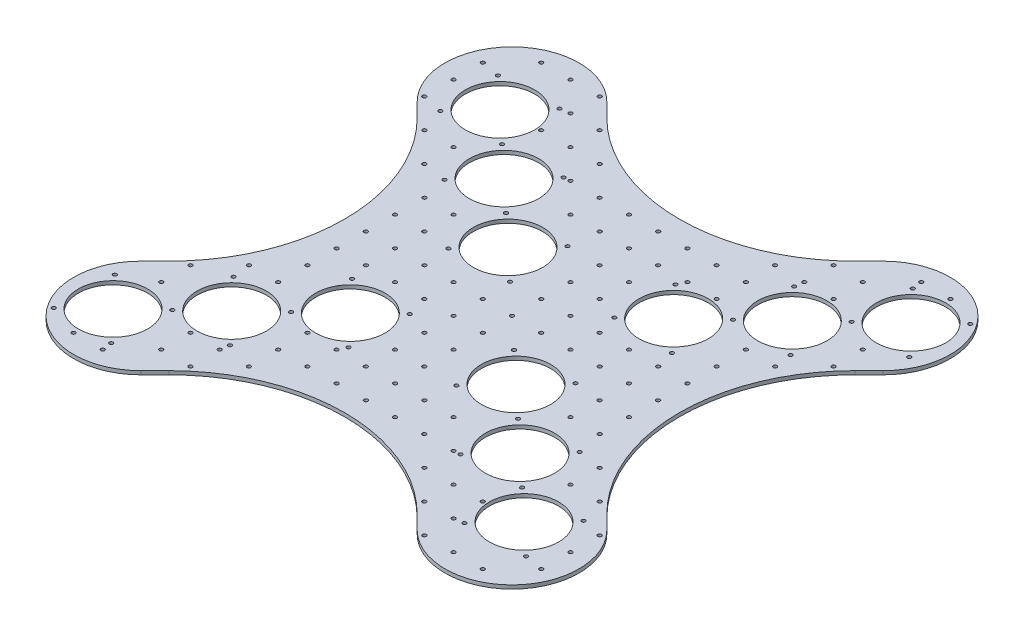
from build123d import *

# Parameters (mm, degrees)
BOSS_EXTRUDE1_DEPTH          = 1.5875
SKETCH4_R                    = 30.13075
CUT_EXTRUDE1_DEPTH           = 21.5875
SKETCH6_R                    = 30.13075
CUT_EXTRUDE2_DEPTH           = 21.5875
CIRPATTERN1_COUNT            = 2
SKETCH7_R                    = 1.625
CUT_EXTRUDE3_DEPTH           = 311.459884602
LPATTERN1_COUNT              = 9
LPATTERN1_PITCH              = 25.4
LPATTERN1_COUNT_DIR2         = 9
LPATTERN1_PITCH_DIR2         = 25.4
LPATTERN2_COUNT              = 9
LPATTERN2_PITCH              = 25.4
LPATTERN2_COUNT_DIR2         = 9
LPATTERN2_PITCH_DIR2         = 25.4
SKETCH8_R                    = 1.625
CUT_EXTRUDE4_DEPTH           = 21.5875
CIRPATTERN2_COUNT            = 2
CIRPATTERN2_COPY_1_SKETCH_R  = 1.625
CIRPATTERN2_COPY_1_DEPTH     = 311.459884602
CIRPATTERN2_COPY_2_SKETCH_R  = 1.625
CIRPATTERN2_COPY_2_DEPTH     = 311.459884602
CIRPATTERN2_COPY_3_SKETCH_R  = 1.625
CIRPATTERN2_COPY_3_DEPTH     = 311.459884602
CIRPATTERN2_COPY_4_SKETCH_R  = 1.625
CIRPATTERN2_COPY_4_DEPTH     = 311.459884602
CIRPATTERN2_COPY_5_SKETCH_R  = 1.625
CIRPATTERN2_COPY_5_DEPTH     = 311.459884602
CIRPATTERN2_COPY_6_SKETCH_R  = 1.625
CIRPATTERN2_COPY_6_DEPTH     = 311.459884602
CIRPATTERN2_COPY_7_SKETCH_R  = 1.625
CIRPATTERN2_COPY_7_DEPTH     = 311.459884602
CIRPATTERN2_COPY_8_SKETCH_R  = 1.625
CIRPATTERN2_COPY_8_DEPTH     = 311.459884602
CIRPATTERN2_COPY_9_SKETCH_R  = 1.625
CIRPATTERN2_COPY_9_DEPTH     = 311.459884602
CIRPATTERN2_COPY_10_SKETCH_R = 1.625
CIRPATTERN2_COPY_10_DEPTH    = 311.459884602
CIRPATTERN2_COPY_11_SKETCH_R = 1.625
CIRPATTERN2_COPY_11_DEPTH    = 311.459884602
CIRPATTERN2_COPY_12_SKETCH_R = 1.625
CIRPATTERN2_COPY_12_DEPTH    = 311.459884602
CIRPATTERN2_COPY_13_SKETCH_R = 1.625
CIRPATTERN2_COPY_13_DEPTH    = 311.459884602
CIRPATTERN2_COPY_14_SKETCH_R = 1.625
CIRPATTERN2_COPY_14_DEPTH    = 311.459884602
CIRPATTERN2_COPY_15_SKETCH_R = 1.625
CIRPATTERN2_COPY_15_DEPTH    = 311.459884602
CIRPATTERN2_COPY_16_SKETCH_R = 1.625
CIRPATTERN2_COPY_16_DEPTH    = 311.459884602
CIRPATTERN2_COPY_17_SKETCH_R = 1.625
CIRPATTERN2_COPY_17_DEPTH    = 311.459884602
CIRPATTERN2_COPY_18_SKETCH_R = 1.625
CIRPATTERN2_COPY_18_DEPTH    = 311.459884602
CIRPATTERN2_COPY_19_SKETCH_R = 1.625
CIRPATTERN2_COPY_19_DEPTH    = 311.459884602
CIRPATTERN2_COPY_20_SKETCH_R = 1.625
CIRPATTERN2_COPY_20_DEPTH    = 311.459884602
CIRPATTERN2_COPY_21_SKETCH_R = 1.625
CIRPATTERN2_COPY_21_DEPTH    = 311.459884602
CIRPATTERN2_COPY_22_SKETCH_R = 1.625
CIRPATTERN2_COPY_22_DEPTH    = 311.459884602
CIRPATTERN2_COPY_23_SKETCH_R = 1.625
CIRPATTERN2_COPY_23_DEPTH    = 311.459884602
CIRPATTERN2_COPY_24_SKETCH_R = 1.625
CIRPATTERN2_COPY_24_DEPTH    = 311.459884602
CIRPATTERN2_COPY_25_SKETCH_R = 1.625
CIRPATTERN2_COPY_25_DEPTH    = 311.459884602
CIRPATTERN2_COPY_26_SKETCH_R = 1.625
CIRPATTERN2_COPY_26_DEPTH    = 311.459884602
CIRPATTERN2_COPY_27_SKETCH_R = 1.625
CIRPATTERN2_COPY_27_DEPTH    = 311.459884602
CIRPATTERN2_COPY_28_SKETCH_R = 1.625
CIRPATTERN2_COPY_28_DEPTH    = 311.459884602
CIRPATTERN2_COPY_29_SKETCH_R = 1.625
CIRPATTERN2_COPY_29_DEPTH    = 311.459884602
CIRPATTERN2_COPY_30_SKETCH_R = 1.625
CIRPATTERN2_COPY_30_DEPTH    = 311.459884602
CIRPATTERN2_COPY_31_SKETCH_R = 1.625
CIRPATTERN2_COPY_31_DEPTH    = 311.459884602
CIRPATTERN2_COPY_32_SKETCH_R = 1.625
CIRPATTERN2_COPY_32_DEPTH    = 311.459884602
CIRPATTERN2_COPY_33_SKETCH_R = 1.625
CIRPATTERN2_COPY_33_DEPTH    = 311.459884602
CIRPATTERN2_COPY_34_SKETCH_R = 1.625
CIRPATTERN2_COPY_34_DEPTH    = 311.459884602
CIRPATTERN2_COPY_35_SKETCH_R = 1.625
CIRPATTERN2_COPY_35_DEPTH    = 311.459884602
CIRPATTERN2_COPY_36_SKETCH_R = 1.625
CIRPATTERN2_COPY_36_DEPTH    = 311.459884602
CIRPATTERN2_COPY_37_SKETCH_R = 1.625
CIRPATTERN2_COPY_37_DEPTH    = 311.459884602
CIRPATTERN2_COPY_38_SKETCH_R = 1.625
CIRPATTERN2_COPY_38_DEPTH    = 311.459884602
CIRPATTERN2_COPY_39_SKETCH_R = 1.625
CIRPATTERN2_COPY_39_DEPTH    = 311.459884602
CIRPATTERN2_COPY_40_SKETCH_R = 1.625
CIRPATTERN2_COPY_40_DEPTH    = 311.459884602
CIRPATTERN2_COPY_41_SKETCH_R = 1.625
CIRPATTERN2_COPY_41_DEPTH    = 311.459884602
CIRPATTERN2_COPY_42_SKETCH_R = 1.625
CIRPATTERN2_COPY_42_DEPTH    = 311.459884602
CIRPATTERN2_COPY_43_SKETCH_R = 1.625
CIRPATTERN2_COPY_43_DEPTH    = 311.459884602
CIRPATTERN2_COPY_44_SKETCH_R = 1.625
CIRPATTERN2_COPY_44_DEPTH    = 311.459884602
CIRPATTERN2_COPY_45_SKETCH_R = 1.625
CIRPATTERN2_COPY_45_DEPTH    = 311.459884602
CIRPATTERN2_COPY_46_SKETCH_R = 1.625
CIRPATTERN2_COPY_46_DEPTH    = 311.459884602
CIRPATTERN2_COPY_47_SKETCH_R = 1.625
CIRPATTERN2_COPY_47_DEPTH    = 311.459884602
CIRPATTERN2_COPY_48_SKETCH_R = 1.625
CIRPATTERN2_COPY_48_DEPTH    = 311.459884602
CIRPATTERN2_COPY_49_SKETCH_R = 1.625
CIRPATTERN2_COPY_49_DEPTH    = 311.459884602
CIRPATTERN2_COPY_50_SKETCH_R = 1.625
CIRPATTERN2_COPY_50_DEPTH    = 311.459884602
CIRPATTERN2_COPY_51_SKETCH_R = 1.625
CIRPATTERN2_COPY_51_DEPTH    = 311.459884602
CIRPATTERN2_COPY_52_SKETCH_R = 1.625
CIRPATTERN2_COPY_52_DEPTH    = 311.459884602
CIRPATTERN2_COPY_53_SKETCH_R = 1.625
CIRPATTERN2_COPY_53_DEPTH    = 311.459884602
CIRPATTERN2_COPY_54_SKETCH_R = 1.625
CIRPATTERN2_COPY_54_DEPTH    = 311.459884602
CIRPATTERN2_COPY_55_SKETCH_R = 1.625
CIRPATTERN2_COPY_55_DEPTH    = 311.459884602
CIRPATTERN2_COPY_56_SKETCH_R = 1.625
CIRPATTERN2_COPY_56_DEPTH    = 311.459884602
CIRPATTERN2_COPY_57_SKETCH_R = 1.625
CIRPATTERN2_COPY_57_DEPTH    = 311.459884602
CIRPATTERN2_COPY_58_SKETCH_R = 1.625
CIRPATTERN2_COPY_58_DEPTH    = 311.459884602
CIRPATTERN2_COPY_59_SKETCH_R = 1.625
CIRPATTERN2_COPY_59_DEPTH    = 311.459884602
CIRPATTERN2_COPY_60_SKETCH_R = 1.625
CIRPATTERN2_COPY_60_DEPTH    = 311.459884602
CIRPATTERN2_COPY_61_SKETCH_R = 1.625
CIRPATTERN2_COPY_61_DEPTH    = 311.459884602
CIRPATTERN2_COPY_62_SKETCH_R = 1.625
CIRPATTERN2_COPY_62_DEPTH    = 311.459884602
CIRPATTERN2_COPY_63_SKETCH_R = 1.625
CIRPATTERN2_COPY_63_DEPTH    = 311.459884602
CIRPATTERN2_COPY_64_SKETCH_R = 1.625
CIRPATTERN2_COPY_64_DEPTH    = 311.459884602
CIRPATTERN2_COPY_65_SKETCH_R = 1.625
CIRPATTERN2_COPY_65_DEPTH    = 311.459884602
CIRPATTERN2_COPY_66_SKETCH_R = 1.625
CIRPATTERN2_COPY_66_DEPTH    = 311.459884602
CIRPATTERN2_COPY_67_SKETCH_R = 1.625
CIRPATTERN2_COPY_67_DEPTH    = 311.459884602
CIRPATTERN2_COPY_68_SKETCH_R = 1.625
CIRPATTERN2_COPY_68_DEPTH    = 311.459884602
CIRPATTERN2_COPY_69_SKETCH_R = 1.625
CIRPATTERN2_COPY_69_DEPTH    = 311.459884602
CIRPATTERN2_COPY_70_SKETCH_R = 1.625
CIRPATTERN2_COPY_70_DEPTH    = 311.459884602
CIRPATTERN2_COPY_71_SKETCH_R = 1.625
CIRPATTERN2_COPY_71_DEPTH    = 311.459884602


with BuildPart() as part:
    # Sketch1 → Boss-Extrude1 (new, symmetric)
    with BuildSketch(Plane(origin=(0, 0, 0), x_dir=(1, 0, 0), z_dir=(0, 1, 0))):
        with BuildLine():
            Line((-190.154460754, 107.762695964), (-202.452679034, 120.061000404))
            ThreePointArc((-202.452679034, 120.061000404), (-202.452390416, 202.453243922), (-120.060146898, 202.452955298))
            Line((-120.060146898, 202.452955298), (-107.761363744, 190.154085975))
            ThreePointArc((-107.761363744, 190.154085975), (0.001019493, 145.516781928), (107.764028179, 190.152575998))
            Line((107.764028179, 190.152575998), (120.062983665, 202.451272988))
            ThreePointArc((120.062983665, 202.451272988), (202.451549268, 202.450695774), (202.451549265, 120.062130169))
            Line((202.451549265, 120.062130169), (190.152201229, 107.762695964))
            ThreePointArc((190.152201229, 107.762695964), (145.515652169, 0), (190.152201229, -107.762695964))
            Line((190.152201229, -107.762695964), (202.451549266, -120.062130169))
            ThreePointArc((202.451549266, -120.062130169), (202.451404963, -202.451969845), (120.061565286, -202.452114149))
            Line((120.061565286, -202.452114149), (107.762695964, -190.153330992))
            ThreePointArc((107.762695964, -190.153330992), (0, -145.516781932), (-107.762695964, -190.153330992))
            Line((-107.762695964, -190.153330992), (-120.061565287, -202.45211415))
            ThreePointArc((-120.061565287, -202.45211415), (-202.452534728, -202.451969845), (-202.452679033, -120.061000404))
            Line((-202.452679033, -120.061000404), (-190.154460754, -107.762695964))
            ThreePointArc((-190.154460754, -107.762695964), (-145.517911694, 0), (-190.154460754, 107.762695964))
        make_face()
    extrude(amount=BOSS_EXTRUDE1_DEPTH, both=True)

    # Sketch4 → Cut-Extrude1 (cut, symmetric)
    with BuildSketch(Plane(origin=(0, 0, 0), x_dir=(1, 0, 0), z_dir=(0, 1, 0))):
        with Locations((-160.269527718, 149.81709656)):
            Circle(SKETCH4_R)
        with Locations((178.568793895, 168.115212398)):
            Circle(SKETCH4_R)
    cut_extrude1 = extrude(amount=CUT_EXTRUDE1_DEPTH, both=True, mode=Mode.SUBTRACT)

    # Sketch6 → Cut-Extrude2 (cut, symmetric)
    with BuildSketch(Plane(origin=(0, 0, 0), x_dir=(1, 0, 0), z_dir=(0, 1, 0))):
        with Locations((125.459741077, 118.115212398)):
            Circle(SKETCH6_R)
        with Locations((-106.7811304, 99.81709656)):
            Circle(SKETCH6_R)
        with Locations((-53.292733081, 49.81709656)):
            Circle(SKETCH6_R)
        with Locations((72.350688259, 68.115212398)):
            Circle(SKETCH6_R)
    cut_extrude2 = extrude(amount=CUT_EXTRUDE2_DEPTH, both=True, mode=Mode.SUBTRACT)

    # CirPattern1: Cut-Extrude1, Cut-Extrude2 ×2 about axis
    cirpattern1_axis = Axis((0, 0, 0), (0, 1, 0))
    add([cut_extrude1.rotate(cirpattern1_axis, i * 360 / CIRPATTERN1_COUNT) for i in range(1, CIRPATTERN1_COUNT)], mode=Mode.SUBTRACT)
    add([cut_extrude2.rotate(cirpattern1_axis, i * 360 / CIRPATTERN1_COUNT) for i in range(1, CIRPATTERN1_COUNT)], mode=Mode.SUBTRACT)

    # Sketch7 → Cut-Extrude3 (cut, through all)
    with BuildSketch(Plane(origin=(0, 1.5875, 0), x_dir=(1, 0, 0), z_dir=(0, 1, 0))):
        with Locations((2e-09, -1e-09)):
            Circle(SKETCH7_R)
    cut_extrude3 = extrude(amount=-CUT_EXTRUDE3_DEPTH, mode=Mode.SUBTRACT)

    # LPattern1: Cut-Extrude3 9 × 9, 44 skipped
    with Locations(*[(i * LPATTERN1_PITCH, 0, -j * LPATTERN1_PITCH_DIR2) for i in range(LPATTERN1_COUNT) for j in range(LPATTERN1_COUNT_DIR2) if (i, j) not in ((0, 0), (0, 6), (0, 7), (0, 8), (1, 6), (1, 7), (1, 8), (2, 2), (2, 3), (2, 6), (2, 7), (2, 8), (3, 2), (3, 3), (3, 7), (3, 8), (4, 2), (4, 3), (4, 4), (4, 5), (4, 8), (5, 4), (5, 5), (5, 8), (6, 0), (6, 1), (6, 2), (6, 4), (6, 5), (6, 6), (6, 7), (7, 0), (7, 1), (7, 2), (7, 3), (7, 6), (7, 7), (8, 0), (8, 1), (8, 2), (8, 4), (8, 5), (8, 6), (8, 7), (8, 8))]):
        add(cut_extrude3, mode=Mode.SUBTRACT)

    # LPattern2: Cut-Extrude3 9 × 9, 47 skipped
    with Locations(*[(-i * LPATTERN2_PITCH, 0, -j * LPATTERN2_PITCH_DIR2) for i in range(LPATTERN2_COUNT) for j in range(LPATTERN2_COUNT_DIR2) if (i, j) not in ((0, 0), (0, 6), (0, 7), (0, 8), (1, 1), (1, 2), (1, 3), (1, 6), (1, 7), (1, 8), (2, 1), (2, 2), (2, 3), (2, 6), (2, 7), (2, 8), (3, 1), (3, 2), (3, 3), (3, 4), (3, 7), (3, 8), (4, 3), (4, 4), (4, 5), (4, 8), (5, 3), (5, 4), (5, 5), (6, 0), (6, 1), (6, 2), (6, 5), (6, 6), (6, 7), (7, 0), (7, 1), (7, 2), (7, 3), (7, 5), (7, 6), (7, 7), (8, 0), (8, 1), (8, 2), (8, 3), (8, 4), (8, 8))]):
        add(cut_extrude3, mode=Mode.SUBTRACT)

    # Sketch8 → Cut-Extrude4 (cut, symmetric)
    with BuildSketch(Plane(origin=(0, 0, 0), x_dir=(1, 0, 0), z_dir=(0, 1, 0))):
        with Locations((-80.03693174, 74.81709656)):
            Circle(SKETCH8_R)
        with Locations((-133.525329059, 124.81709656)):
            Circle(SKETCH8_R)
        with Locations((98.905214668, 93.115212398)):
            Circle(SKETCH8_R)
        with Locations((152.014267486, 143.115212398)):
            Circle(SKETCH8_R)
        with Locations((-187.013726377, 174.81709656)):
            Circle(SKETCH8_R)
        with Locations((-185.269527718, 123.072897901)):
            Circle(SKETCH8_R)
        with Locations((-135.269527718, 176.561295219)):
            Circle(SKETCH8_R)
        with Locations((-81.7811304, 126.561295219)):
            Circle(SKETCH8_R)
        with Locations((-131.7811304, 73.072897901)):
            Circle(SKETCH8_R)
        with Locations((-26.548534422, 24.81709656)):
            Circle(SKETCH8_R)
        with Locations((-78.292733081, 23.072897901)):
            Circle(SKETCH8_R)
        with Locations((-28.292733081, 76.561295219)):
            Circle(SKETCH8_R)
        with Locations((45.79616185, 43.115212398)):
            Circle(SKETCH8_R)
        with Locations((97.350688259, 41.560685989)):
            Circle(SKETCH8_R)
        with Locations((47.350688259, 94.669738807)):
            Circle(SKETCH8_R)
        with Locations((150.459741077, 91.560685989)):
            Circle(SKETCH8_R)
        with Locations((100.459741077, 144.669738807)):
            Circle(SKETCH8_R)
        with Locations((203.568793895, 141.560685989)):
            Circle(SKETCH8_R)
        with Locations((153.568793895, 194.669738807)):
            Circle(SKETCH8_R)
        with Locations((205.123320304, 193.115212398)):
            Circle(SKETCH8_R)
    cut_extrude4 = extrude(amount=CUT_EXTRUDE4_DEPTH, both=True, mode=Mode.SUBTRACT)

    # CirPattern2: Cut-Extrude4 ×2 about axis
    cirpattern2_axis = Axis((0, 0, 0), (0, 1, 0))
    for i in range(1, CIRPATTERN2_COUNT):
        add(cut_extrude4.rotate(cirpattern2_axis, i * 360 / CIRPATTERN2_COUNT), mode=Mode.SUBTRACT)

    # CirPattern2 copy 1 sketch → CirPattern2 copy 1 (cut, through all)
    with BuildSketch(Plane(origin=(0, 1.5875, 25.4), x_dir=(-1, 0, 0), z_dir=(0, 1, 0))):
        with Locations((2e-09, -1e-09)):
            Circle(CIRPATTERN2_COPY_1_SKETCH_R)
    extrude(amount=-CIRPATTERN2_COPY_1_DEPTH, mode=Mode.SUBTRACT)

    # CirPattern2 copy 2 sketch → CirPattern2 copy 2 (cut, through all)
    with BuildSketch(Plane(origin=(0, 1.5875, 50.8), x_dir=(-1, 0, 0), z_dir=(0, 1, 0))):
        with Locations((2e-09, -1e-09)):
            Circle(CIRPATTERN2_COPY_2_SKETCH_R)
    extrude(amount=-CIRPATTERN2_COPY_2_DEPTH, mode=Mode.SUBTRACT)

    # CirPattern2 copy 3 sketch → CirPattern2 copy 3 (cut, through all)
    with BuildSketch(Plane(origin=(0, 1.5875, 76.2), x_dir=(-1, 0, 0), z_dir=(0, 1, 0))):
        with Locations((2e-09, -1e-09)):
            Circle(CIRPATTERN2_COPY_3_SKETCH_R)
    extrude(amount=-CIRPATTERN2_COPY_3_DEPTH, mode=Mode.SUBTRACT)

    # CirPattern2 copy 4 sketch → CirPattern2 copy 4 (cut, through all)
    with BuildSketch(Plane(origin=(0, 1.5875, 101.6), x_dir=(-1, 0, 0), z_dir=(0, 1, 0))):
        with Locations((2e-09, -1e-09)):
            Circle(CIRPATTERN2_COPY_4_SKETCH_R)
    extrude(amount=-CIRPATTERN2_COPY_4_DEPTH, mode=Mode.SUBTRACT)

    # CirPattern2 copy 5 sketch → CirPattern2 copy 5 (cut, through all)
    with BuildSketch(Plane(origin=(0, 1.5875, 127), x_dir=(-1, 0, 0), z_dir=(0, 1, 0))):
        with Locations((2e-09, -1e-09)):
            Circle(CIRPATTERN2_COPY_5_SKETCH_R)
    extrude(amount=-CIRPATTERN2_COPY_5_DEPTH, mode=Mode.SUBTRACT)

    # CirPattern2 copy 6 sketch → CirPattern2 copy 6 (cut, through all)
    with BuildSketch(Plane(origin=(-25.4, 1.5875, 0), x_dir=(-1, 0, 0), z_dir=(0, 1, 0))):
        with Locations((2e-09, -1e-09)):
            Circle(CIRPATTERN2_COPY_6_SKETCH_R)
    extrude(amount=-CIRPATTERN2_COPY_6_DEPTH, mode=Mode.SUBTRACT)

    # CirPattern2 copy 7 sketch → CirPattern2 copy 7 (cut, through all)
    with BuildSketch(Plane(origin=(-25.4, 1.5875, 25.4), x_dir=(-1, 0, 0), z_dir=(0, 1, 0))):
        with Locations((2e-09, -1e-09)):
            Circle(CIRPATTERN2_COPY_7_SKETCH_R)
    extrude(amount=-CIRPATTERN2_COPY_7_DEPTH, mode=Mode.SUBTRACT)

    # CirPattern2 copy 8 sketch → CirPattern2 copy 8 (cut, through all)
    with BuildSketch(Plane(origin=(-25.4, 1.5875, 50.8), x_dir=(-1, 0, 0), z_dir=(0, 1, 0))):
        with Locations((2e-09, -1e-09)):
            Circle(CIRPATTERN2_COPY_8_SKETCH_R)
    extrude(amount=-CIRPATTERN2_COPY_8_DEPTH, mode=Mode.SUBTRACT)

    # CirPattern2 copy 9 sketch → CirPattern2 copy 9 (cut, through all)
    with BuildSketch(Plane(origin=(-25.4, 1.5875, 76.2), x_dir=(-1, 0, 0), z_dir=(0, 1, 0))):
        with Locations((2e-09, -1e-09)):
            Circle(CIRPATTERN2_COPY_9_SKETCH_R)
    extrude(amount=-CIRPATTERN2_COPY_9_DEPTH, mode=Mode.SUBTRACT)

    # CirPattern2 copy 10 sketch → CirPattern2 copy 10 (cut, through all)
    with BuildSketch(Plane(origin=(-25.4, 1.5875, 101.6), x_dir=(-1, 0, 0), z_dir=(0, 1, 0))):
        with Locations((2e-09, -1e-09)):
            Circle(CIRPATTERN2_COPY_10_SKETCH_R)
    extrude(amount=-CIRPATTERN2_COPY_10_DEPTH, mode=Mode.SUBTRACT)

    # CirPattern2 copy 11 sketch → CirPattern2 copy 11 (cut, through all)
    with BuildSketch(Plane(origin=(-25.4, 1.5875, 127), x_dir=(-1, 0, 0), z_dir=(0, 1, 0))):
        with Locations((2e-09, -1e-09)):
            Circle(CIRPATTERN2_COPY_11_SKETCH_R)
    extrude(amount=-CIRPATTERN2_COPY_11_DEPTH, mode=Mode.SUBTRACT)

    # CirPattern2 copy 12 sketch → CirPattern2 copy 12 (cut, through all)
    with BuildSketch(Plane(origin=(-50.8, 1.5875, 0), x_dir=(-1, 0, 0), z_dir=(0, 1, 0))):
        with Locations((2e-09, -1e-09)):
            Circle(CIRPATTERN2_COPY_12_SKETCH_R)
    extrude(amount=-CIRPATTERN2_COPY_12_DEPTH, mode=Mode.SUBTRACT)

    # CirPattern2 copy 13 sketch → CirPattern2 copy 13 (cut, through all)
    with BuildSketch(Plane(origin=(-50.8, 1.5875, 25.4), x_dir=(-1, 0, 0), z_dir=(0, 1, 0))):
        with Locations((2e-09, -1e-09)):
            Circle(CIRPATTERN2_COPY_13_SKETCH_R)
    extrude(amount=-CIRPATTERN2_COPY_13_DEPTH, mode=Mode.SUBTRACT)

    # CirPattern2 copy 14 sketch → CirPattern2 copy 14 (cut, through all)
    with BuildSketch(Plane(origin=(-50.8, 1.5875, 101.6), x_dir=(-1, 0, 0), z_dir=(0, 1, 0))):
        with Locations((2e-09, -1e-09)):
            Circle(CIRPATTERN2_COPY_14_SKETCH_R)
    extrude(amount=-CIRPATTERN2_COPY_14_DEPTH, mode=Mode.SUBTRACT)

    # CirPattern2 copy 15 sketch → CirPattern2 copy 15 (cut, through all)
    with BuildSketch(Plane(origin=(-50.8, 1.5875, 127), x_dir=(-1, 0, 0), z_dir=(0, 1, 0))):
        with Locations((2e-09, -1e-09)):
            Circle(CIRPATTERN2_COPY_15_SKETCH_R)
    extrude(amount=-CIRPATTERN2_COPY_15_DEPTH, mode=Mode.SUBTRACT)

    # CirPattern2 copy 16 sketch → CirPattern2 copy 16 (cut, through all)
    with BuildSketch(Plane(origin=(-76.2, 1.5875, 0), x_dir=(-1, 0, 0), z_dir=(0, 1, 0))):
        with Locations((2e-09, -1e-09)):
            Circle(CIRPATTERN2_COPY_16_SKETCH_R)
    extrude(amount=-CIRPATTERN2_COPY_16_DEPTH, mode=Mode.SUBTRACT)

    # CirPattern2 copy 17 sketch → CirPattern2 copy 17 (cut, through all)
    with BuildSketch(Plane(origin=(-76.2, 1.5875, 25.4), x_dir=(-1, 0, 0), z_dir=(0, 1, 0))):
        with Locations((2e-09, -1e-09)):
            Circle(CIRPATTERN2_COPY_17_SKETCH_R)
    extrude(amount=-CIRPATTERN2_COPY_17_DEPTH, mode=Mode.SUBTRACT)

    # CirPattern2 copy 18 sketch → CirPattern2 copy 18 (cut, through all)
    with BuildSketch(Plane(origin=(-76.2, 1.5875, 101.6), x_dir=(-1, 0, 0), z_dir=(0, 1, 0))):
        with Locations((2e-09, -1e-09)):
            Circle(CIRPATTERN2_COPY_18_SKETCH_R)
    extrude(amount=-CIRPATTERN2_COPY_18_DEPTH, mode=Mode.SUBTRACT)

    # CirPattern2 copy 19 sketch → CirPattern2 copy 19 (cut, through all)
    with BuildSketch(Plane(origin=(-76.2, 1.5875, 127), x_dir=(-1, 0, 0), z_dir=(0, 1, 0))):
        with Locations((2e-09, -1e-09)):
            Circle(CIRPATTERN2_COPY_19_SKETCH_R)
    extrude(amount=-CIRPATTERN2_COPY_19_DEPTH, mode=Mode.SUBTRACT)

    # CirPattern2 copy 20 sketch → CirPattern2 copy 20 (cut, through all)
    with BuildSketch(Plane(origin=(-76.2, 1.5875, 152.4), x_dir=(-1, 0, 0), z_dir=(0, 1, 0))):
        with Locations((2e-09, -1e-09)):
            Circle(CIRPATTERN2_COPY_20_SKETCH_R)
    extrude(amount=-CIRPATTERN2_COPY_20_DEPTH, mode=Mode.SUBTRACT)

    # CirPattern2 copy 21 sketch → CirPattern2 copy 21 (cut, through all)
    with BuildSketch(Plane(origin=(-101.6, 1.5875, 0), x_dir=(-1, 0, 0), z_dir=(0, 1, 0))):
        with Locations((2e-09, -1e-09)):
            Circle(CIRPATTERN2_COPY_21_SKETCH_R)
    extrude(amount=-CIRPATTERN2_COPY_21_DEPTH, mode=Mode.SUBTRACT)

    # CirPattern2 copy 22 sketch → CirPattern2 copy 22 (cut, through all)
    with BuildSketch(Plane(origin=(-101.6, 1.5875, 25.4), x_dir=(-1, 0, 0), z_dir=(0, 1, 0))):
        with Locations((2e-09, -1e-09)):
            Circle(CIRPATTERN2_COPY_22_SKETCH_R)
    extrude(amount=-CIRPATTERN2_COPY_22_DEPTH, mode=Mode.SUBTRACT)

    # CirPattern2 copy 23 sketch → CirPattern2 copy 23 (cut, through all)
    with BuildSketch(Plane(origin=(-101.6, 1.5875, 152.4), x_dir=(-1, 0, 0), z_dir=(0, 1, 0))):
        with Locations((2e-09, -1e-09)):
            Circle(CIRPATTERN2_COPY_23_SKETCH_R)
    extrude(amount=-CIRPATTERN2_COPY_23_DEPTH, mode=Mode.SUBTRACT)

    # CirPattern2 copy 24 sketch → CirPattern2 copy 24 (cut, through all)
    with BuildSketch(Plane(origin=(-101.6, 1.5875, 177.8), x_dir=(-1, 0, 0), z_dir=(0, 1, 0))):
        with Locations((2e-09, -1e-09)):
            Circle(CIRPATTERN2_COPY_24_SKETCH_R)
    extrude(amount=-CIRPATTERN2_COPY_24_DEPTH, mode=Mode.SUBTRACT)

    # CirPattern2 copy 25 sketch → CirPattern2 copy 25 (cut, through all)
    with BuildSketch(Plane(origin=(-127, 1.5875, 0), x_dir=(-1, 0, 0), z_dir=(0, 1, 0))):
        with Locations((2e-09, -1e-09)):
            Circle(CIRPATTERN2_COPY_25_SKETCH_R)
    extrude(amount=-CIRPATTERN2_COPY_25_DEPTH, mode=Mode.SUBTRACT)

    # CirPattern2 copy 26 sketch → CirPattern2 copy 26 (cut, through all)
    with BuildSketch(Plane(origin=(-127, 1.5875, 25.4), x_dir=(-1, 0, 0), z_dir=(0, 1, 0))):
        with Locations((2e-09, -1e-09)):
            Circle(CIRPATTERN2_COPY_26_SKETCH_R)
    extrude(amount=-CIRPATTERN2_COPY_26_DEPTH, mode=Mode.SUBTRACT)

    # CirPattern2 copy 27 sketch → CirPattern2 copy 27 (cut, through all)
    with BuildSketch(Plane(origin=(-127, 1.5875, 50.8), x_dir=(-1, 0, 0), z_dir=(0, 1, 0))):
        with Locations((2e-09, -1e-09)):
            Circle(CIRPATTERN2_COPY_27_SKETCH_R)
    extrude(amount=-CIRPATTERN2_COPY_27_DEPTH, mode=Mode.SUBTRACT)

    # CirPattern2 copy 28 sketch → CirPattern2 copy 28 (cut, through all)
    with BuildSketch(Plane(origin=(-127, 1.5875, 76.2), x_dir=(-1, 0, 0), z_dir=(0, 1, 0))):
        with Locations((2e-09, -1e-09)):
            Circle(CIRPATTERN2_COPY_28_SKETCH_R)
    extrude(amount=-CIRPATTERN2_COPY_28_DEPTH, mode=Mode.SUBTRACT)

    # CirPattern2 copy 29 sketch → CirPattern2 copy 29 (cut, through all)
    with BuildSketch(Plane(origin=(-127, 1.5875, 152.4), x_dir=(-1, 0, 0), z_dir=(0, 1, 0))):
        with Locations((2e-09, -1e-09)):
            Circle(CIRPATTERN2_COPY_29_SKETCH_R)
    extrude(amount=-CIRPATTERN2_COPY_29_DEPTH, mode=Mode.SUBTRACT)

    # CirPattern2 copy 30 sketch → CirPattern2 copy 30 (cut, through all)
    with BuildSketch(Plane(origin=(-127, 1.5875, 177.8), x_dir=(-1, 0, 0), z_dir=(0, 1, 0))):
        with Locations((2e-09, -1e-09)):
            Circle(CIRPATTERN2_COPY_30_SKETCH_R)
    extrude(amount=-CIRPATTERN2_COPY_30_DEPTH, mode=Mode.SUBTRACT)

    # CirPattern2 copy 31 sketch → CirPattern2 copy 31 (cut, through all)
    with BuildSketch(Plane(origin=(-152.4, 1.5875, 76.2), x_dir=(-1, 0, 0), z_dir=(0, 1, 0))):
        with Locations((2e-09, -1e-09)):
            Circle(CIRPATTERN2_COPY_31_SKETCH_R)
    extrude(amount=-CIRPATTERN2_COPY_31_DEPTH, mode=Mode.SUBTRACT)

    # CirPattern2 copy 32 sketch → CirPattern2 copy 32 (cut, through all)
    with BuildSketch(Plane(origin=(-152.4, 1.5875, 203.2), x_dir=(-1, 0, 0), z_dir=(0, 1, 0))):
        with Locations((2e-09, -1e-09)):
            Circle(CIRPATTERN2_COPY_32_SKETCH_R)
    extrude(amount=-CIRPATTERN2_COPY_32_DEPTH, mode=Mode.SUBTRACT)

    # CirPattern2 copy 33 sketch → CirPattern2 copy 33 (cut, through all)
    with BuildSketch(Plane(origin=(-177.8, 1.5875, 101.6), x_dir=(-1, 0, 0), z_dir=(0, 1, 0))):
        with Locations((2e-09, -1e-09)):
            Circle(CIRPATTERN2_COPY_33_SKETCH_R)
    extrude(amount=-CIRPATTERN2_COPY_33_DEPTH, mode=Mode.SUBTRACT)

    # CirPattern2 copy 34 sketch → CirPattern2 copy 34 (cut, through all)
    with BuildSketch(Plane(origin=(-177.8, 1.5875, 127), x_dir=(-1, 0, 0), z_dir=(0, 1, 0))):
        with Locations((2e-09, -1e-09)):
            Circle(CIRPATTERN2_COPY_34_SKETCH_R)
    extrude(amount=-CIRPATTERN2_COPY_34_DEPTH, mode=Mode.SUBTRACT)

    # CirPattern2 copy 35 sketch → CirPattern2 copy 35 (cut, through all)
    with BuildSketch(Plane(origin=(-177.8, 1.5875, 203.2), x_dir=(-1, 0, 0), z_dir=(0, 1, 0))):
        with Locations((2e-09, -1e-09)):
            Circle(CIRPATTERN2_COPY_35_SKETCH_R)
    extrude(amount=-CIRPATTERN2_COPY_35_DEPTH, mode=Mode.SUBTRACT)

    # CirPattern2 copy 36 sketch → CirPattern2 copy 36 (cut, through all)
    with BuildSketch(Plane(origin=(-203.2, 1.5875, 76.2), x_dir=(-1, 0, 0), z_dir=(0, 1, 0))):
        with Locations((2e-09, -1e-09)):
            Circle(CIRPATTERN2_COPY_36_SKETCH_R)
    extrude(amount=-CIRPATTERN2_COPY_36_DEPTH, mode=Mode.SUBTRACT)

    # CirPattern2 copy 37 sketch → CirPattern2 copy 37 (cut, through all)
    with BuildSketch(Plane(origin=(0, 1.5875, 0), x_dir=(-1, 0, 0), z_dir=(0, 1, 0))):
        with Locations((2e-09, -1e-09)):
            Circle(CIRPATTERN2_COPY_37_SKETCH_R)
    extrude(amount=-CIRPATTERN2_COPY_37_DEPTH, mode=Mode.SUBTRACT)

    # CirPattern2 copy 38 sketch → CirPattern2 copy 38 (cut, through all)
    with BuildSketch(Plane(origin=(0, 1.5875, 25.4), x_dir=(-1, 0, 0), z_dir=(0, 1, 0))):
        with Locations((2e-09, -1e-09)):
            Circle(CIRPATTERN2_COPY_38_SKETCH_R)
    extrude(amount=-CIRPATTERN2_COPY_38_DEPTH, mode=Mode.SUBTRACT)

    # CirPattern2 copy 39 sketch → CirPattern2 copy 39 (cut, through all)
    with BuildSketch(Plane(origin=(0, 1.5875, 50.8), x_dir=(-1, 0, 0), z_dir=(0, 1, 0))):
        with Locations((2e-09, -1e-09)):
            Circle(CIRPATTERN2_COPY_39_SKETCH_R)
    extrude(amount=-CIRPATTERN2_COPY_39_DEPTH, mode=Mode.SUBTRACT)

    # CirPattern2 copy 40 sketch → CirPattern2 copy 40 (cut, through all)
    with BuildSketch(Plane(origin=(0, 1.5875, 76.2), x_dir=(-1, 0, 0), z_dir=(0, 1, 0))):
        with Locations((2e-09, -1e-09)):
            Circle(CIRPATTERN2_COPY_40_SKETCH_R)
    extrude(amount=-CIRPATTERN2_COPY_40_DEPTH, mode=Mode.SUBTRACT)

    # CirPattern2 copy 41 sketch → CirPattern2 copy 41 (cut, through all)
    with BuildSketch(Plane(origin=(0, 1.5875, 101.6), x_dir=(-1, 0, 0), z_dir=(0, 1, 0))):
        with Locations((2e-09, -1e-09)):
            Circle(CIRPATTERN2_COPY_41_SKETCH_R)
    extrude(amount=-CIRPATTERN2_COPY_41_DEPTH, mode=Mode.SUBTRACT)

    # CirPattern2 copy 42 sketch → CirPattern2 copy 42 (cut, through all)
    with BuildSketch(Plane(origin=(0, 1.5875, 127), x_dir=(-1, 0, 0), z_dir=(0, 1, 0))):
        with Locations((2e-09, -1e-09)):
            Circle(CIRPATTERN2_COPY_42_SKETCH_R)
    extrude(amount=-CIRPATTERN2_COPY_42_DEPTH, mode=Mode.SUBTRACT)

    # CirPattern2 copy 43 sketch → CirPattern2 copy 43 (cut, through all)
    with BuildSketch(Plane(origin=(25.4, 1.5875, 0), x_dir=(-1, 0, 0), z_dir=(0, 1, 0))):
        with Locations((2e-09, -1e-09)):
            Circle(CIRPATTERN2_COPY_43_SKETCH_R)
    extrude(amount=-CIRPATTERN2_COPY_43_DEPTH, mode=Mode.SUBTRACT)

    # CirPattern2 copy 44 sketch → CirPattern2 copy 44 (cut, through all)
    with BuildSketch(Plane(origin=(25.4, 1.5875, 101.6), x_dir=(-1, 0, 0), z_dir=(0, 1, 0))):
        with Locations((2e-09, -1e-09)):
            Circle(CIRPATTERN2_COPY_44_SKETCH_R)
    extrude(amount=-CIRPATTERN2_COPY_44_DEPTH, mode=Mode.SUBTRACT)

    # CirPattern2 copy 45 sketch → CirPattern2 copy 45 (cut, through all)
    with BuildSketch(Plane(origin=(25.4, 1.5875, 127), x_dir=(-1, 0, 0), z_dir=(0, 1, 0))):
        with Locations((2e-09, -1e-09)):
            Circle(CIRPATTERN2_COPY_45_SKETCH_R)
    extrude(amount=-CIRPATTERN2_COPY_45_DEPTH, mode=Mode.SUBTRACT)

    # CirPattern2 copy 46 sketch → CirPattern2 copy 46 (cut, through all)
    with BuildSketch(Plane(origin=(50.8, 1.5875, 0), x_dir=(-1, 0, 0), z_dir=(0, 1, 0))):
        with Locations((2e-09, -1e-09)):
            Circle(CIRPATTERN2_COPY_46_SKETCH_R)
    extrude(amount=-CIRPATTERN2_COPY_46_DEPTH, mode=Mode.SUBTRACT)

    # CirPattern2 copy 47 sketch → CirPattern2 copy 47 (cut, through all)
    with BuildSketch(Plane(origin=(50.8, 1.5875, 101.6), x_dir=(-1, 0, 0), z_dir=(0, 1, 0))):
        with Locations((2e-09, -1e-09)):
            Circle(CIRPATTERN2_COPY_47_SKETCH_R)
    extrude(amount=-CIRPATTERN2_COPY_47_DEPTH, mode=Mode.SUBTRACT)

    # CirPattern2 copy 48 sketch → CirPattern2 copy 48 (cut, through all)
    with BuildSketch(Plane(origin=(50.8, 1.5875, 127), x_dir=(-1, 0, 0), z_dir=(0, 1, 0))):
        with Locations((2e-09, -1e-09)):
            Circle(CIRPATTERN2_COPY_48_SKETCH_R)
    extrude(amount=-CIRPATTERN2_COPY_48_DEPTH, mode=Mode.SUBTRACT)

    # CirPattern2 copy 49 sketch → CirPattern2 copy 49 (cut, through all)
    with BuildSketch(Plane(origin=(76.2, 1.5875, 0), x_dir=(-1, 0, 0), z_dir=(0, 1, 0))):
        with Locations((2e-09, -1e-09)):
            Circle(CIRPATTERN2_COPY_49_SKETCH_R)
    extrude(amount=-CIRPATTERN2_COPY_49_DEPTH, mode=Mode.SUBTRACT)

    # CirPattern2 copy 50 sketch → CirPattern2 copy 50 (cut, through all)
    with BuildSketch(Plane(origin=(76.2, 1.5875, 127), x_dir=(-1, 0, 0), z_dir=(0, 1, 0))):
        with Locations((2e-09, -1e-09)):
            Circle(CIRPATTERN2_COPY_50_SKETCH_R)
    extrude(amount=-CIRPATTERN2_COPY_50_DEPTH, mode=Mode.SUBTRACT)

    # CirPattern2 copy 51 sketch → CirPattern2 copy 51 (cut, through all)
    with BuildSketch(Plane(origin=(76.2, 1.5875, 152.4), x_dir=(-1, 0, 0), z_dir=(0, 1, 0))):
        with Locations((2e-09, -1e-09)):
            Circle(CIRPATTERN2_COPY_51_SKETCH_R)
    extrude(amount=-CIRPATTERN2_COPY_51_DEPTH, mode=Mode.SUBTRACT)

    # CirPattern2 copy 52 sketch → CirPattern2 copy 52 (cut, through all)
    with BuildSketch(Plane(origin=(101.6, 1.5875, 0), x_dir=(-1, 0, 0), z_dir=(0, 1, 0))):
        with Locations((2e-09, -1e-09)):
            Circle(CIRPATTERN2_COPY_52_SKETCH_R)
    extrude(amount=-CIRPATTERN2_COPY_52_DEPTH, mode=Mode.SUBTRACT)

    # CirPattern2 copy 53 sketch → CirPattern2 copy 53 (cut, through all)
    with BuildSketch(Plane(origin=(101.6, 1.5875, 25.4), x_dir=(-1, 0, 0), z_dir=(0, 1, 0))):
        with Locations((2e-09, -1e-09)):
            Circle(CIRPATTERN2_COPY_53_SKETCH_R)
    extrude(amount=-CIRPATTERN2_COPY_53_DEPTH, mode=Mode.SUBTRACT)

    # CirPattern2 copy 54 sketch → CirPattern2 copy 54 (cut, through all)
    with BuildSketch(Plane(origin=(101.6, 1.5875, 50.8), x_dir=(-1, 0, 0), z_dir=(0, 1, 0))):
        with Locations((2e-09, -1e-09)):
            Circle(CIRPATTERN2_COPY_54_SKETCH_R)
    extrude(amount=-CIRPATTERN2_COPY_54_DEPTH, mode=Mode.SUBTRACT)

    # CirPattern2 copy 55 sketch → CirPattern2 copy 55 (cut, through all)
    with BuildSketch(Plane(origin=(101.6, 1.5875, 152.4), x_dir=(-1, 0, 0), z_dir=(0, 1, 0))):
        with Locations((2e-09, -1e-09)):
            Circle(CIRPATTERN2_COPY_55_SKETCH_R)
    extrude(amount=-CIRPATTERN2_COPY_55_DEPTH, mode=Mode.SUBTRACT)

    # CirPattern2 copy 56 sketch → CirPattern2 copy 56 (cut, through all)
    with BuildSketch(Plane(origin=(101.6, 1.5875, 177.8), x_dir=(-1, 0, 0), z_dir=(0, 1, 0))):
        with Locations((2e-09, -1e-09)):
            Circle(CIRPATTERN2_COPY_56_SKETCH_R)
    extrude(amount=-CIRPATTERN2_COPY_56_DEPTH, mode=Mode.SUBTRACT)

    # CirPattern2 copy 57 sketch → CirPattern2 copy 57 (cut, through all)
    with BuildSketch(Plane(origin=(127, 1.5875, 0), x_dir=(-1, 0, 0), z_dir=(0, 1, 0))):
        with Locations((2e-09, -1e-09)):
            Circle(CIRPATTERN2_COPY_57_SKETCH_R)
    extrude(amount=-CIRPATTERN2_COPY_57_DEPTH, mode=Mode.SUBTRACT)

    # CirPattern2 copy 58 sketch → CirPattern2 copy 58 (cut, through all)
    with BuildSketch(Plane(origin=(127, 1.5875, 25.4), x_dir=(-1, 0, 0), z_dir=(0, 1, 0))):
        with Locations((2e-09, -1e-09)):
            Circle(CIRPATTERN2_COPY_58_SKETCH_R)
    extrude(amount=-CIRPATTERN2_COPY_58_DEPTH, mode=Mode.SUBTRACT)

    # CirPattern2 copy 59 sketch → CirPattern2 copy 59 (cut, through all)
    with BuildSketch(Plane(origin=(127, 1.5875, 50.8), x_dir=(-1, 0, 0), z_dir=(0, 1, 0))):
        with Locations((2e-09, -1e-09)):
            Circle(CIRPATTERN2_COPY_59_SKETCH_R)
    extrude(amount=-CIRPATTERN2_COPY_59_DEPTH, mode=Mode.SUBTRACT)

    # CirPattern2 copy 60 sketch → CirPattern2 copy 60 (cut, through all)
    with BuildSketch(Plane(origin=(127, 1.5875, 152.4), x_dir=(-1, 0, 0), z_dir=(0, 1, 0))):
        with Locations((2e-09, -1e-09)):
            Circle(CIRPATTERN2_COPY_60_SKETCH_R)
    extrude(amount=-CIRPATTERN2_COPY_60_DEPTH, mode=Mode.SUBTRACT)

    # CirPattern2 copy 61 sketch → CirPattern2 copy 61 (cut, through all)
    with BuildSketch(Plane(origin=(127, 1.5875, 177.8), x_dir=(-1, 0, 0), z_dir=(0, 1, 0))):
        with Locations((2e-09, -1e-09)):
            Circle(CIRPATTERN2_COPY_61_SKETCH_R)
    extrude(amount=-CIRPATTERN2_COPY_61_DEPTH, mode=Mode.SUBTRACT)

    # CirPattern2 copy 62 sketch → CirPattern2 copy 62 (cut, through all)
    with BuildSketch(Plane(origin=(127, 1.5875, 203.2), x_dir=(-1, 0, 0), z_dir=(0, 1, 0))):
        with Locations((2e-09, -1e-09)):
            Circle(CIRPATTERN2_COPY_62_SKETCH_R)
    extrude(amount=-CIRPATTERN2_COPY_62_DEPTH, mode=Mode.SUBTRACT)

    # CirPattern2 copy 63 sketch → CirPattern2 copy 63 (cut, through all)
    with BuildSketch(Plane(origin=(152.4, 1.5875, 76.2), x_dir=(-1, 0, 0), z_dir=(0, 1, 0))):
        with Locations((2e-09, -1e-09)):
            Circle(CIRPATTERN2_COPY_63_SKETCH_R)
    extrude(amount=-CIRPATTERN2_COPY_63_DEPTH, mode=Mode.SUBTRACT)

    # CirPattern2 copy 64 sketch → CirPattern2 copy 64 (cut, through all)
    with BuildSketch(Plane(origin=(152.4, 1.5875, 101.6), x_dir=(-1, 0, 0), z_dir=(0, 1, 0))):
        with Locations((2e-09, -1e-09)):
            Circle(CIRPATTERN2_COPY_64_SKETCH_R)
    extrude(amount=-CIRPATTERN2_COPY_64_DEPTH, mode=Mode.SUBTRACT)

    # CirPattern2 copy 65 sketch → CirPattern2 copy 65 (cut, through all)
    with BuildSketch(Plane(origin=(152.4, 1.5875, 203.2), x_dir=(-1, 0, 0), z_dir=(0, 1, 0))):
        with Locations((2e-09, -1e-09)):
            Circle(CIRPATTERN2_COPY_65_SKETCH_R)
    extrude(amount=-CIRPATTERN2_COPY_65_DEPTH, mode=Mode.SUBTRACT)

    # CirPattern2 copy 66 sketch → CirPattern2 copy 66 (cut, through all)
    with BuildSketch(Plane(origin=(177.8, 1.5875, 101.6), x_dir=(-1, 0, 0), z_dir=(0, 1, 0))):
        with Locations((2e-09, -1e-09)):
            Circle(CIRPATTERN2_COPY_66_SKETCH_R)
    extrude(amount=-CIRPATTERN2_COPY_66_DEPTH, mode=Mode.SUBTRACT)

    # CirPattern2 copy 67 sketch → CirPattern2 copy 67 (cut, through all)
    with BuildSketch(Plane(origin=(177.8, 1.5875, 203.2), x_dir=(-1, 0, 0), z_dir=(0, 1, 0))):
        with Locations((2e-09, -1e-09)):
            Circle(CIRPATTERN2_COPY_67_SKETCH_R)
    extrude(amount=-CIRPATTERN2_COPY_67_DEPTH, mode=Mode.SUBTRACT)

    # CirPattern2 copy 68 sketch → CirPattern2 copy 68 (cut, through all)
    with BuildSketch(Plane(origin=(203.2, 1.5875, 127), x_dir=(-1, 0, 0), z_dir=(0, 1, 0))):
        with Locations((2e-09, -1e-09)):
            Circle(CIRPATTERN2_COPY_68_SKETCH_R)
    extrude(amount=-CIRPATTERN2_COPY_68_DEPTH, mode=Mode.SUBTRACT)

    # CirPattern2 copy 69 sketch → CirPattern2 copy 69 (cut, through all)
    with BuildSketch(Plane(origin=(203.2, 1.5875, 152.4), x_dir=(-1, 0, 0), z_dir=(0, 1, 0))):
        with Locations((2e-09, -1e-09)):
            Circle(CIRPATTERN2_COPY_69_SKETCH_R)
    extrude(amount=-CIRPATTERN2_COPY_69_DEPTH, mode=Mode.SUBTRACT)

    # CirPattern2 copy 70 sketch → CirPattern2 copy 70 (cut, through all)
    with BuildSketch(Plane(origin=(203.2, 1.5875, 177.8), x_dir=(-1, 0, 0), z_dir=(0, 1, 0))):
        with Locations((2e-09, -1e-09)):
            Circle(CIRPATTERN2_COPY_70_SKETCH_R)
    extrude(amount=-CIRPATTERN2_COPY_70_DEPTH, mode=Mode.SUBTRACT)

    # CirPattern2 copy 71 sketch → CirPattern2 copy 71 (cut, through all)
    with BuildSketch(Plane(origin=(0, 1.5875, 0), x_dir=(-1, 0, 0), z_dir=(0, 1, 0))):
        with Locations((2e-09, -1e-09)):
            Circle(CIRPATTERN2_COPY_71_SKETCH_R)
    extrude(amount=-CIRPATTERN2_COPY_71_DEPTH, mode=Mode.SUBTRACT)


solid = part.part
